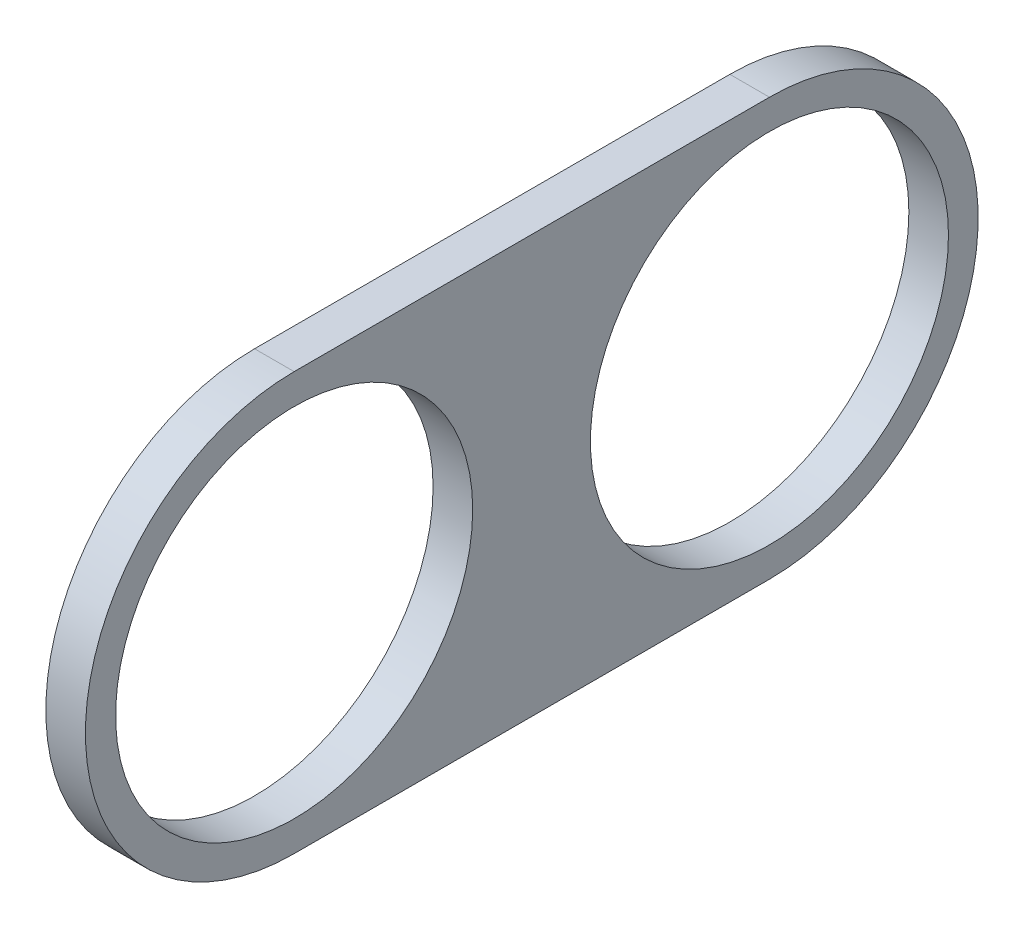
from build123d import *

# Parameters (mm, degrees)
SKETCH1_R           = 14.351
SKETCH1_R_2         = 14.3129
BOSS_EXTRUDE1_DEPTH = 3.175


with BuildPart() as part:
    # Sketch1 → Boss-Extrude1 (new body)
    with BuildSketch(Plane(origin=(0, 0, 0), x_dir=(0, 0, -1), z_dir=(1, 0, 0))):
        with BuildLine():
            Line((-19.05, 16.73225), (19.05, 16.73225))
            ThreePointArc((19.05, 16.73225), (35.78225, 0), (19.05, -16.73225))
            Line((19.05, -16.73225), (-19.05, -16.73225))
            ThreePointArc((-19.05, -16.73225), (-35.78225, 0), (-19.05, 16.73225))
        make_face()
        with Locations((19.05, 0)):
            Circle(SKETCH1_R, mode=Mode.SUBTRACT)
        with Locations((-19.05, 0)):
            Circle(SKETCH1_R_2, mode=Mode.SUBTRACT)
    extrude(amount=BOSS_EXTRUDE1_DEPTH)


solid = part.part
